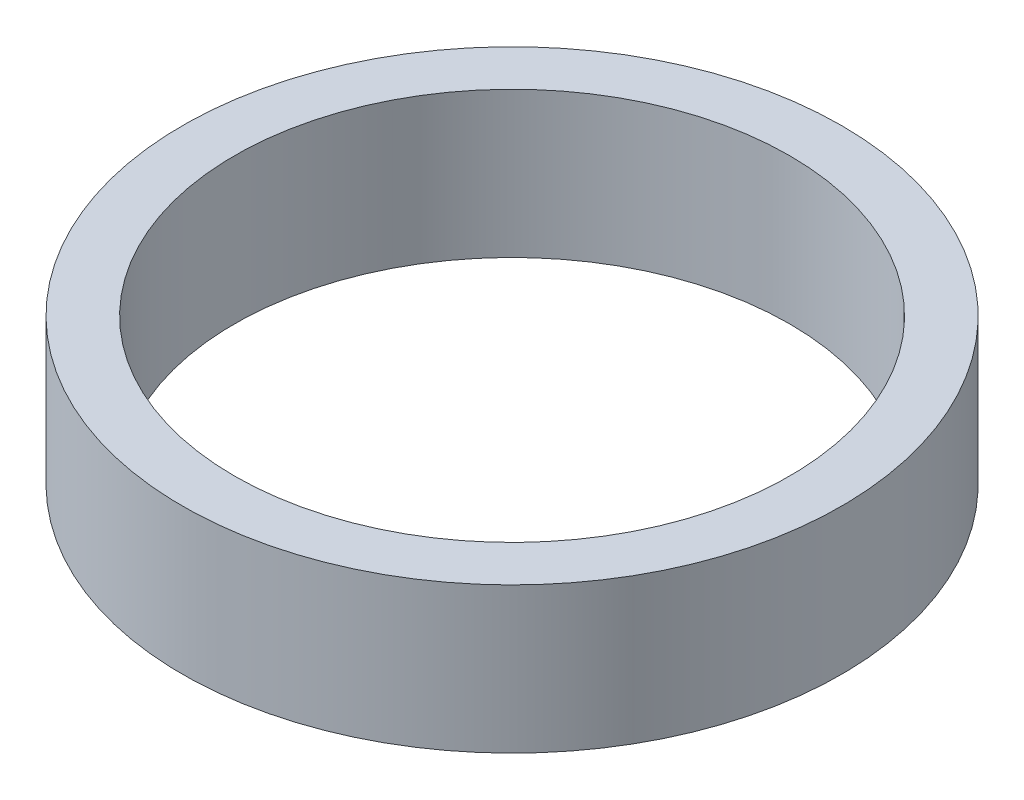
from build123d import *

# Parameters (mm, degrees)
SKETCH1_R           = 47.5
BOSS_EXTRUDE1_DEPTH = 21
SKETCH2_R           = 40
CUT_EXTRUDE1_DEPTH  = 71.381105419


with BuildPart() as part:
    # Sketch1 → Boss-Extrude1 (new body)
    with BuildSketch(Plane(origin=(0, 0, 0), x_dir=(1, 0, 0), z_dir=(0, 1, 0))):
        Circle(SKETCH1_R)
    extrude(amount=BOSS_EXTRUDE1_DEPTH)

    # Sketch2 → Cut-Extrude1 (cut, through all)
    with BuildSketch(Plane(origin=(0, 0, 0), x_dir=(1, 0, 0), z_dir=(0, 1, 0))):
        Circle(SKETCH2_R)
    extrude(amount=CUT_EXTRUDE1_DEPTH, mode=Mode.SUBTRACT)


solid = part.part
